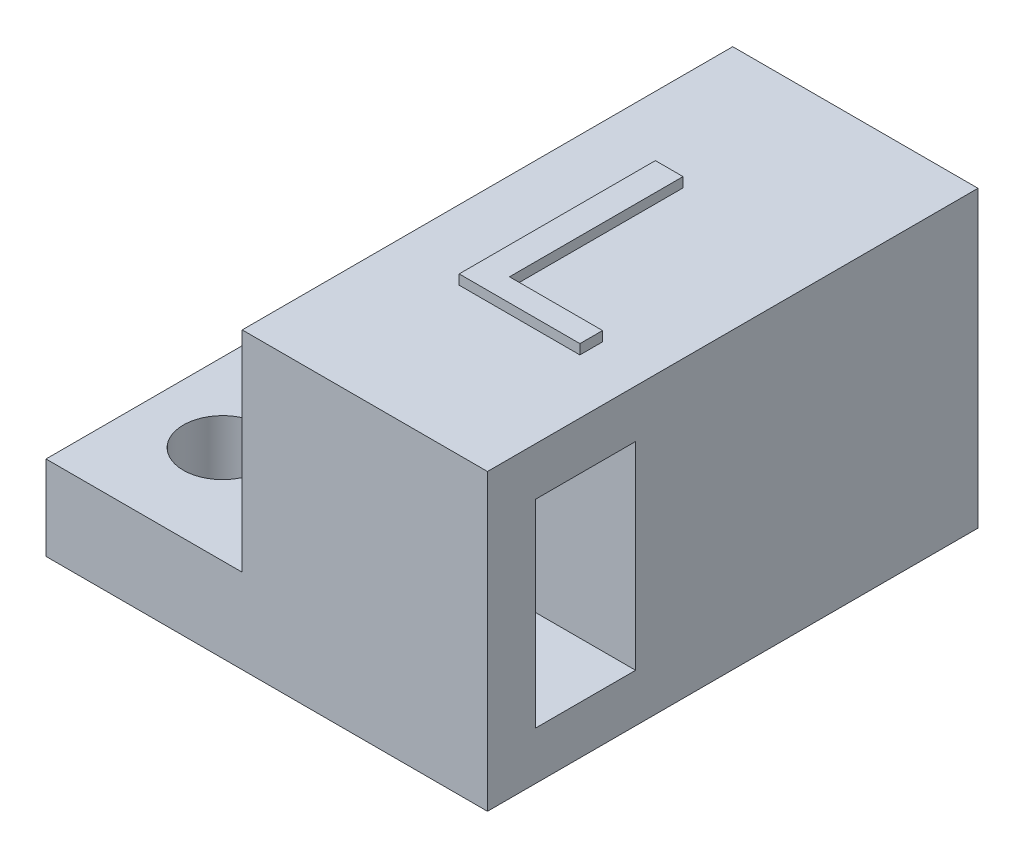
from build123d import *

# Parameters (mm, degrees)
SKETCH1_W           = 25
SKETCH1_H           = 50
BOSS_EXTRUDE1_DEPTH = 30
SKETCH2_W           = 50
SKETCH2_H           = 8.605036789
BOSS_EXTRUDE2_DEPTH = 20
SKETCH3_R           = 4
CUT_EXTRUDE1_DEPTH  = 47.249264327
SKETCH4_W           = 10.2
SKETCH4_H           = 20.2
CUT_EXTRUDE2_DEPTH  = 20
BOSS_EXTRUDE3_DEPTH = 1


with BuildPart() as part:
    # Sketch1 → Boss-Extrude1 (new body)
    with BuildSketch(Plane(origin=(0, 0, 0), x_dir=(1, 0, 0), z_dir=(0, 1, 0))):
        Rectangle(SKETCH1_W, SKETCH1_H)
    extrude(amount=BOSS_EXTRUDE1_DEPTH)

    # Sketch2 → Boss-Extrude2 (add)
    with BuildSketch(Plane.ZY.offset(12.5)):
        with Locations((0, 4.302518394)):
            Rectangle(SKETCH2_W, SKETCH2_H)
    extrude(amount=BOSS_EXTRUDE2_DEPTH)

    # Sketch3 → Cut-Extrude1 (cut, through all)
    with BuildSketch(Plane(origin=(0, 8.605036789, 0), x_dir=(1, 0, 0), z_dir=(0, 1, 0))):
        with Locations((-24.5, 15)):
            Circle(SKETCH3_R)
        with Locations((-24.5, -15)):
            Circle(SKETCH3_R)
    extrude(amount=-CUT_EXTRUDE1_DEPTH, mode=Mode.SUBTRACT)

    # Sketch4 → Cut-Extrude2 (cut)
    with BuildSketch(Plane(origin=(12.5, 0, 0), x_dir=(0, 0, -1), z_dir=(1, 0, 0))):
        with Locations((-15, 15)):
            Rectangle(SKETCH4_W, SKETCH4_H)
    extrude(amount=-CUT_EXTRUDE2_DEPTH, mode=Mode.SUBTRACT)

    # Sketch5 → Boss-Extrude3 (add)
    with BuildSketch(Plane(origin=(0, 30, 0), x_dir=(1, 0, 0), z_dir=(0, 1, 0))):
        Polygon((-5.384615385, -10), (-5.384615385, 10), (-2.564102564, 10), (-2.564102564, -7.692307692), (6.923076923, -7.692307692), (6.923076923, -10), align=None)
    extrude(amount=BOSS_EXTRUDE3_DEPTH)


solid = part.part
